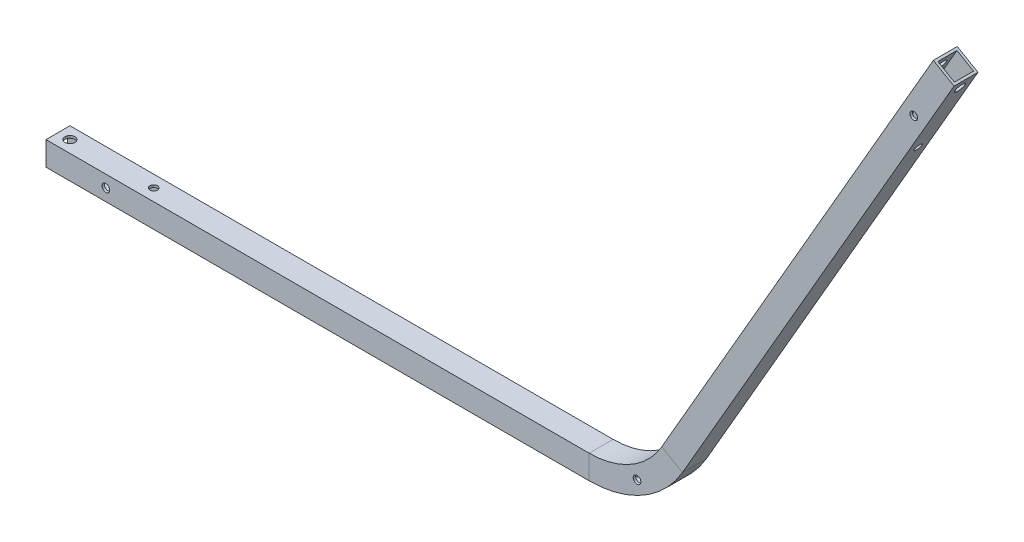
from build123d import *

# Parameters (mm, degrees)
SKETCH_3_W          = 10
SKETCH_3_H          = 10
SKETCH_3_W_2        = 8
SKETCH_3_H_2        = 8
SKETCH_5_R          = 1.6
CUT_EXTRUDE_2_DEPTH = 10
SKETCH_6_R          = 2.1
SKETCH_6_R_2        = 1.6
CUT_EXTRUDE_3_DEPTH = 10
SKETCH_7_R          = 2.1
SKETCH_7_R_2        = 1.6
CUT_EXTRUDE_4_DEPTH = 10


with BuildPart() as part:
    # ｽｲｰﾌﾟ1: sweep along a path in ｽｹｯﾁ2
    with BuildLine(Plane.XY) as sweep_1_path:
        Line((0, 0), (226.905989232, 0))
        ThreePointArc((226.905989232, 0), (246.905989232, 5.358983849), (261.547005384, 20))
        Line((261.547005384, 20), (375, 216.506350946))
    # ｽｹｯﾁ3 → ｽｲｰﾌﾟ1 (sweep)
    with BuildSketch(Plane(origin=(0, 0, 0), x_dir=(0, 0, -1), z_dir=(1, 0, 0))):
        Rectangle(SKETCH_3_W, SKETCH_3_H)
        Rectangle(SKETCH_3_W_2, SKETCH_3_H_2, mode=Mode.SUBTRACT)
    sweep(path=sweep_1_path.line)

    # ｽｹｯﾁ5 → ｶｯﾄ - 押し出し2 (cut)
    with BuildSketch(Plane.XY.offset(5)):
        with Locations((25, 0)):
            Circle(SKETCH_5_R)
        with Locations((362.5, 194.855715851)):
            Circle(SKETCH_5_R)
        with Locations((246.905989232, 5.358983849)):
            Circle(SKETCH_5_R)
    extrude(amount=-CUT_EXTRUDE_2_DEPTH, mode=Mode.SUBTRACT)

    # ｽｹｯﾁ6 → ｶｯﾄ - 押し出し3 (cut)
    with BuildSketch(Plane.XZ.offset(5)):
        with Locations((5, 0)):
            Circle(SKETCH_6_R)
        with Locations((40, 0)):
            Circle(SKETCH_6_R_2)
    extrude(amount=-CUT_EXTRUDE_3_DEPTH, mode=Mode.SUBTRACT)

    # ｽｹｯﾁ7 → ｶｯﾄ - 押し出し4 (cut)
    with BuildSketch(Plane(origin=(191.830127019, -110.753175473, 0), x_dir=(0, 0, -1), z_dir=(0.8660254037844398, -0.49999999999999806, 0))):
        with Locations((0, 370)):
            Circle(SKETCH_7_R)
        with Locations((0, 335)):
            Circle(SKETCH_7_R_2)
    extrude(amount=-CUT_EXTRUDE_4_DEPTH, mode=Mode.SUBTRACT)


solid = part.part
